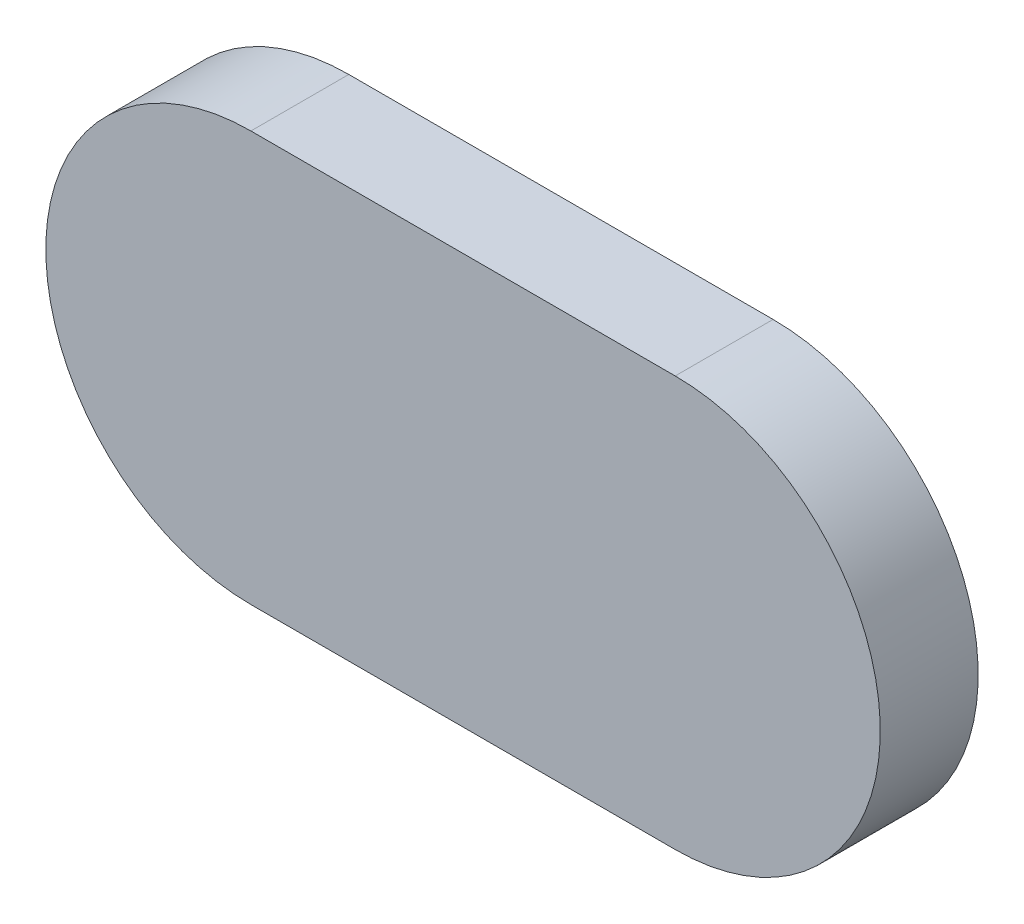
from build123d import *

# Parameters (mm, degrees)
ESQUISSE1_3_R      = 72.5
ESQUISSE1_3_W      = 150
ESQUISSE1_3_H      = 145
BOSS_EXTRU_3_DEPTH = 34.609433402


with BuildPart() as part:
    # Esquisse1<3> → Boss.-Extru.3 (new body)
    with BuildSketch(Plane.XY):
        with Locations((-75, 0.904270006)):
            Circle(ESQUISSE1_3_R)
        with Locations((75, 0.904270006)):
            Circle(ESQUISSE1_3_R)
        with Locations((0, 0.904270006)):
            Rectangle(ESQUISSE1_3_W, ESQUISSE1_3_H)
    extrude(amount=BOSS_EXTRU_3_DEPTH)


solid = part.part
